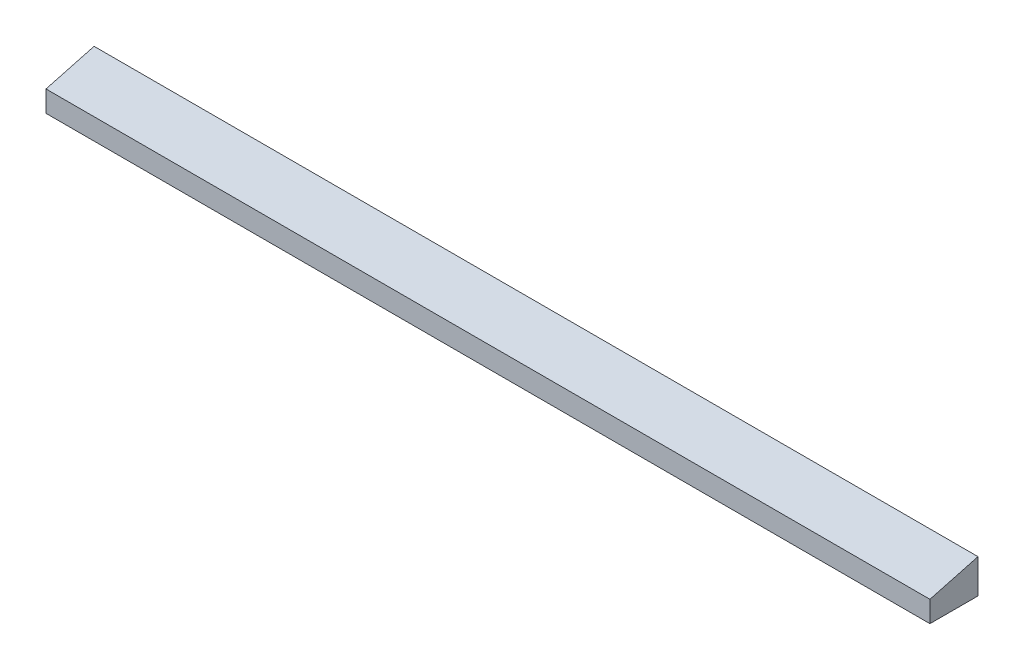
from build123d import *

# Parameters (mm, degrees)
CROQUIS1_W              = 250
CROQUIS1_H              = 10
SALIENTE_EXTRUIR1_DEPTH = 13.6
CHAFL_N1_SIZE           = 15
CHAFL_N1_SIZE_2         = 4.019237886


with BuildPart() as part:
    # Croquis1 → Saliente-Extruir1 (new body)
    with BuildSketch(Plane.XY):
        Rectangle(CROQUIS1_W, CROQUIS1_H)
    extrude(amount=SALIENTE_EXTRUIR1_DEPTH)

    # Chaflán1
    # the kernel refuses this chamfer: 15, 4.019237886 mm, written as the material it takes off along each edge
    with BuildSketch(Plane(origin=(163.950823553, 5, 13.6), x_dir=(0, 0.0099671465771564, -0.9999503267608394), z_dir=(-1, 0, 0))) as chafl_n1_piece_1:
        Polygon((CHAFL_N1_SIZE * 0.999950326761, CHAFL_N1_SIZE * 0.00996714657716), (-CHAFL_N1_SIZE_2 * 0.00996714657831, CHAFL_N1_SIZE_2 * 0.999950326877), (0, 0), align=None)
    extrude(amount=327.901647106, mode=Mode.SUBTRACT)


solid = part.part
